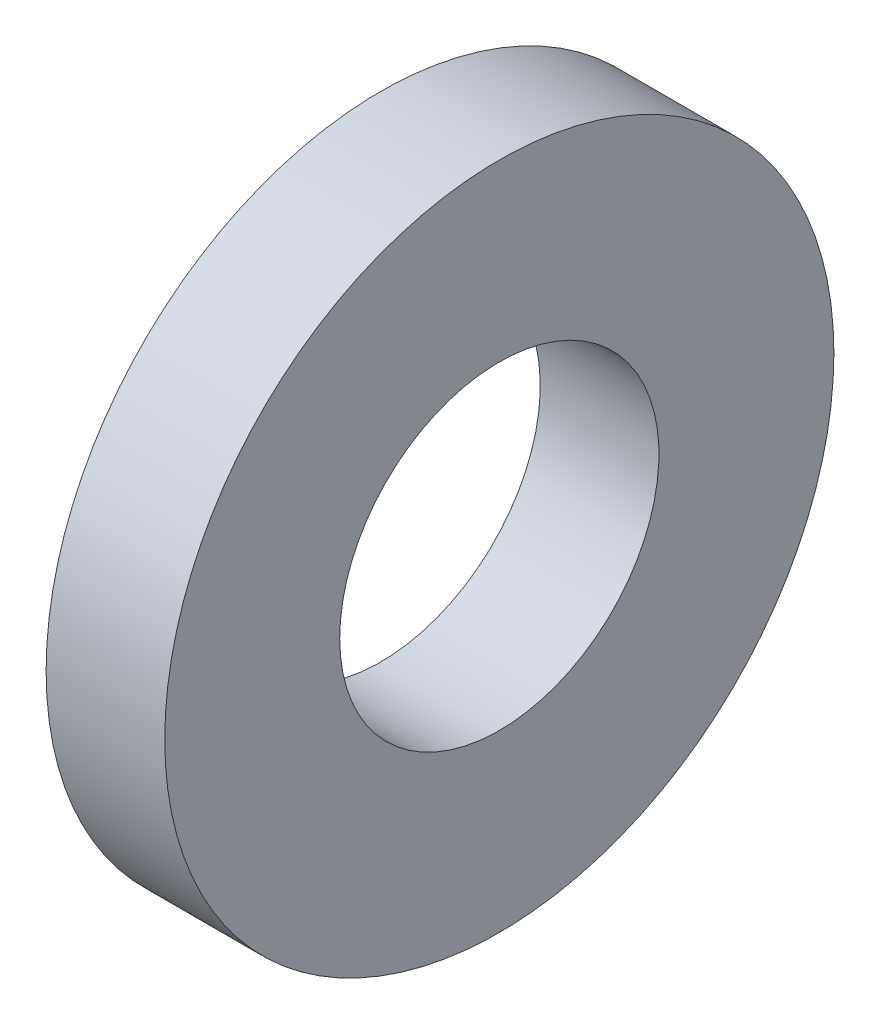
from build123d import *

# Parameters (mm, degrees)
SKETCH1_R      = 26.8605
SKETCH1_R_2    = 12.8143
EXTRUDE1_DEPTH = 9.525


with BuildPart() as part:
    # Sketch1 → Extrude1 (new body)
    with BuildSketch(Plane(origin=(0, 0, 0), x_dir=(0, 0, -1), z_dir=(1, 0, 0))):
        Circle(SKETCH1_R)
        Circle(SKETCH1_R_2, mode=Mode.SUBTRACT)
    extrude(amount=EXTRUDE1_DEPTH)


solid = part.part
